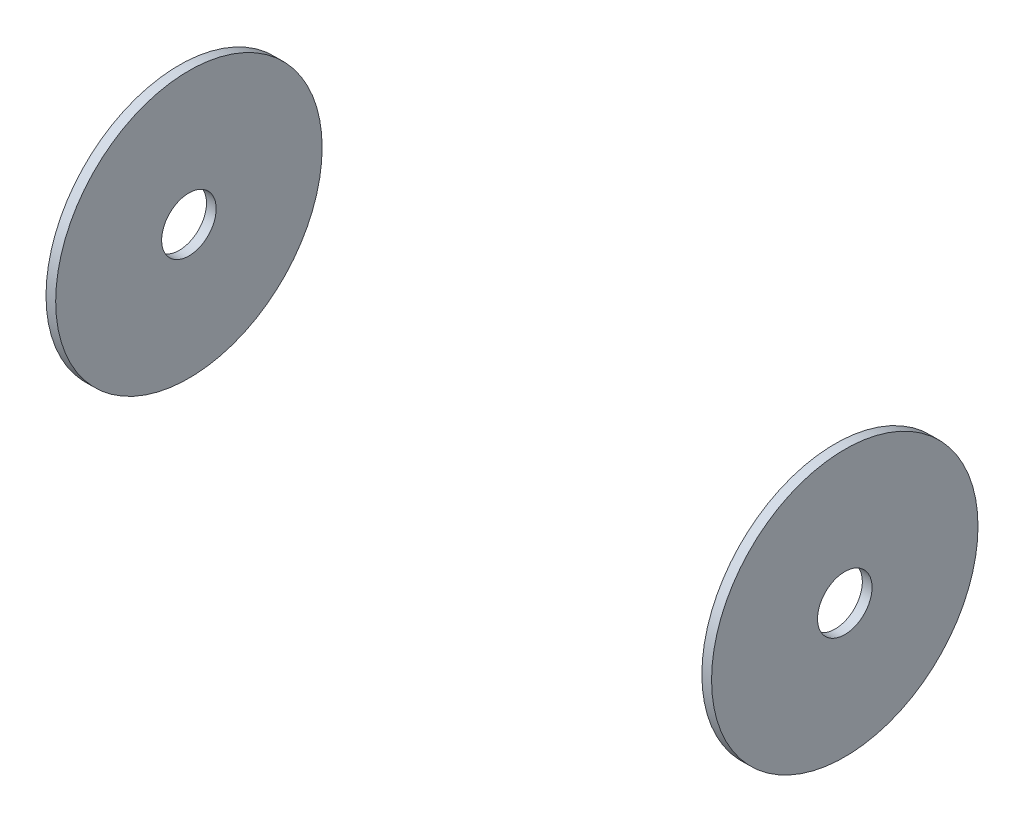
from build123d import *

# Parameters (mm, degrees)
SKETCH1_R           = 20.6375
SKETCH1_R_2         = 4.22275
BOSS_EXTRUDE1_DEPTH = 1.500000048


with BuildPart() as part:
    # Sketch1 → Boss-Extrude1 (new body)
    with BuildSketch(Plane(origin=(50.049999952, 0, 0), x_dir=(0, 0, -1), z_dir=(1, 0, 0))):
        with Locations((-175.399998656, 26.9875)):
            Circle(SKETCH1_R)
        with Locations((-175.399998656, 26.9875)):
            Circle(SKETCH1_R_2, mode=Mode.SUBTRACT)
    extrude(amount=BOSS_EXTRUDE1_DEPTH)


with BuildPart() as body_2:
    # Mirror2: mirrored copy
    add(part.part.mirror(Plane(origin=(0, 0, 0), x_dir=(0, 0, 1), z_dir=(1, 0, 0))))


solid = Compound([part.part, body_2.part])
